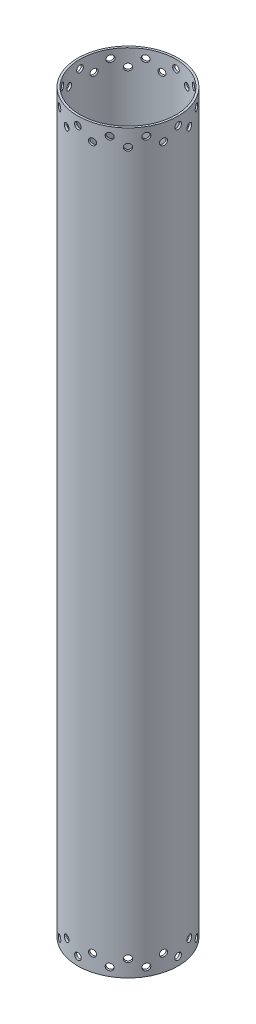
from build123d import *

# Parameters (mm, degrees)
SKETCH2_R                = 76.2
SKETCH2_R_2              = 73.025
BOSS_EXTRUDE1_DEPTH      = 1117.6
SKETCH3_R                = 5.0419
CUT_EXTRUDE1_DEPTH       = 1143
CIRPATTERN1_COUNT        = 12
SKETCH6_R                = 5.0419
CUT_EXTRUDE2_DEPTH       = 25.4
CIRPATTERN2_COUNT        = 12
MIRROR1_COPY_1_SKETCH_R  = 5.0419
MIRROR1_COPY_1_DEPTH     = 1143
MIRROR1_COPY_2_SKETCH_R  = 5.0419
MIRROR1_COPY_2_DEPTH     = 1143
MIRROR1_COPY_3_SKETCH_R  = 5.0419
MIRROR1_COPY_3_DEPTH     = 1143
MIRROR1_COPY_4_SKETCH_R  = 5.0419
MIRROR1_COPY_4_DEPTH     = 1143
MIRROR1_COPY_5_SKETCH_R  = 5.0419
MIRROR1_COPY_5_DEPTH     = 1143
MIRROR1_COPY_6_SKETCH_R  = 5.0419
MIRROR1_COPY_6_DEPTH     = 1143
MIRROR1_COPY_7_SKETCH_R  = 5.0419
MIRROR1_COPY_7_DEPTH     = 1143
MIRROR1_COPY_8_SKETCH_R  = 5.0419
MIRROR1_COPY_8_DEPTH     = 1143
MIRROR1_COPY_9_SKETCH_R  = 5.0419
MIRROR1_COPY_9_DEPTH     = 1143
MIRROR1_COPY_10_SKETCH_R = 5.0419
MIRROR1_COPY_10_DEPTH    = 1143
MIRROR1_COPY_11_SKETCH_R = 5.0419
MIRROR1_COPY_11_DEPTH    = 1143
MIRROR1_COPY_12_SKETCH_R = 5.0419
MIRROR1_COPY_12_DEPTH    = 1143
MIRROR1_COPY_13_SKETCH_R = 5.0419
MIRROR1_COPY_13_DEPTH    = 25.4
MIRROR1_COPY_14_SKETCH_R = 5.0419
MIRROR1_COPY_14_DEPTH    = 25.4
MIRROR1_COPY_15_SKETCH_R = 5.0419
MIRROR1_COPY_15_DEPTH    = 25.4
MIRROR1_COPY_16_SKETCH_R = 5.0419
MIRROR1_COPY_16_DEPTH    = 25.4
MIRROR1_COPY_17_SKETCH_R = 5.0419
MIRROR1_COPY_17_DEPTH    = 25.4
MIRROR1_COPY_18_SKETCH_R = 5.0419
MIRROR1_COPY_18_DEPTH    = 25.4
MIRROR1_COPY_19_SKETCH_R = 5.0419
MIRROR1_COPY_19_DEPTH    = 25.4
MIRROR1_COPY_20_SKETCH_R = 5.0419
MIRROR1_COPY_20_DEPTH    = 25.4
MIRROR1_COPY_21_SKETCH_R = 5.0419
MIRROR1_COPY_21_DEPTH    = 25.4
MIRROR1_COPY_22_SKETCH_R = 5.0419
MIRROR1_COPY_22_DEPTH    = 25.4
MIRROR1_COPY_23_SKETCH_R = 5.0419
MIRROR1_COPY_23_DEPTH    = 25.4
MIRROR1_COPY_24_SKETCH_R = 5.0419
MIRROR1_COPY_24_DEPTH    = 25.4


with BuildPart() as part:
    # Sketch2 → Boss-Extrude1 (new body)
    with BuildSketch(Plane(origin=(0, 0, 0), x_dir=(1, 0, 0), z_dir=(0, 1, 0))):
        Circle(SKETCH2_R)
        Circle(SKETCH2_R_2, mode=Mode.SUBTRACT)
    extrude(amount=BOSS_EXTRUDE1_DEPTH)

    # Sketch3 → Cut-Extrude1 (cut)
    with BuildSketch(Plane.XY):
        with Locations((0, 1104.9)):
            Circle(SKETCH3_R)
    cut_extrude1 = extrude(amount=-CUT_EXTRUDE1_DEPTH, mode=Mode.SUBTRACT)

    # CirPattern1: Cut-Extrude1 ×12 about axis
    cirpattern1_axis = Axis((0, 1117.6, 0), (0, -1, 0))
    for i in range(1, CIRPATTERN1_COUNT):
        add(cut_extrude1.rotate(cirpattern1_axis, i * 360 / CIRPATTERN1_COUNT), mode=Mode.SUBTRACT)

    # Sketch6 → Cut-Extrude2 (cut)
    with BuildSketch(Plane(origin=(-19.722011237, 0, 73.603547963), x_dir=(0, -1, 0), z_dir=(-0.25881904510252135, 0, 0.9659258262890681))):
        with Locations((-1092.2, 0)):
            Circle(SKETCH6_R)
    cut_extrude2 = extrude(amount=-CUT_EXTRUDE2_DEPTH, mode=Mode.SUBTRACT)

    # CirPattern2: Cut-Extrude2 ×12 about axis
    cirpattern2_axis = Axis((0, 1117.6, 0), (0, -1, 0))
    for i in range(1, CIRPATTERN2_COUNT):
        add(cut_extrude2.rotate(cirpattern2_axis, i * 360 / CIRPATTERN2_COUNT), mode=Mode.SUBTRACT)

    # Mirror1 copy 1 sketch → Mirror1 copy 1 (cut)
    with BuildSketch(Plane(origin=(0, 1117.6, 0), x_dir=(0.8660254037844387, 0, 0.49999999999999994), z_dir=(-0.49999999999999994, 0, 0.8660254037844387))):
        with Locations((0, -1104.9)):
            Circle(MIRROR1_COPY_1_SKETCH_R)
    extrude(amount=-MIRROR1_COPY_1_DEPTH, mode=Mode.SUBTRACT)

    # Mirror1 copy 2 sketch → Mirror1 copy 2 (cut)
    with BuildSketch(Plane(origin=(0, 1117.6, 0), x_dir=(0.5000000000000001, 0, 0.8660254037844386), z_dir=(-0.8660254037844386, 0, 0.5000000000000001))):
        with Locations((0, -1104.9)):
            Circle(MIRROR1_COPY_2_SKETCH_R)
    extrude(amount=-MIRROR1_COPY_2_DEPTH, mode=Mode.SUBTRACT)

    # Mirror1 copy 3 sketch → Mirror1 copy 3 (cut)
    with BuildSketch(Plane(origin=(0, 1117.6, 0), x_dir=(0, 0, 1), z_dir=(-1, 0, 0))):
        with Locations((0, -1104.9)):
            Circle(MIRROR1_COPY_3_SKETCH_R)
    extrude(amount=-MIRROR1_COPY_3_DEPTH, mode=Mode.SUBTRACT)

    # Mirror1 copy 4 sketch → Mirror1 copy 4 (cut)
    with BuildSketch(Plane(origin=(0, 1117.6, 0), x_dir=(-0.4999999999999998, 0, 0.8660254037844387), z_dir=(-0.8660254037844387, 0, -0.4999999999999998))):
        with Locations((0, -1104.9)):
            Circle(MIRROR1_COPY_4_SKETCH_R)
    extrude(amount=-MIRROR1_COPY_4_DEPTH, mode=Mode.SUBTRACT)

    # Mirror1 copy 5 sketch → Mirror1 copy 5 (cut)
    with BuildSketch(Plane(origin=(0, 1117.6, 0), x_dir=(-0.8660254037844387, 0, 0.49999999999999994), z_dir=(-0.49999999999999994, 0, -0.8660254037844387))):
        with Locations((0, -1104.9)):
            Circle(MIRROR1_COPY_5_SKETCH_R)
    extrude(amount=-MIRROR1_COPY_5_DEPTH, mode=Mode.SUBTRACT)

    # Mirror1 copy 6 sketch → Mirror1 copy 6 (cut)
    with BuildSketch(Plane(origin=(0, 1117.6, 0), x_dir=(-1, 0, 0), z_dir=(0, 0, -1))):
        with Locations((0, -1104.9)):
            Circle(MIRROR1_COPY_6_SKETCH_R)
    extrude(amount=-MIRROR1_COPY_6_DEPTH, mode=Mode.SUBTRACT)

    # Mirror1 copy 7 sketch → Mirror1 copy 7 (cut)
    with BuildSketch(Plane(origin=(0, 1117.6, 0), x_dir=(-0.8660254037844386, 0, -0.5000000000000001), z_dir=(0.5000000000000001, 0, -0.8660254037844386))):
        with Locations((0, -1104.9)):
            Circle(MIRROR1_COPY_7_SKETCH_R)
    extrude(amount=-MIRROR1_COPY_7_DEPTH, mode=Mode.SUBTRACT)

    # Mirror1 copy 8 sketch → Mirror1 copy 8 (cut)
    with BuildSketch(Plane(origin=(0, 1117.6, 0), x_dir=(-0.5000000000000004, 0, -0.8660254037844384), z_dir=(0.8660254037844384, 0, -0.5000000000000004))):
        with Locations((0, -1104.9)):
            Circle(MIRROR1_COPY_8_SKETCH_R)
    extrude(amount=-MIRROR1_COPY_8_DEPTH, mode=Mode.SUBTRACT)

    # Mirror1 copy 9 sketch → Mirror1 copy 9 (cut)
    with BuildSketch(Plane(origin=(0, 1117.6, 0), x_dir=(0, 0, -1), z_dir=(1, 0, 0))):
        with Locations((0, -1104.9)):
            Circle(MIRROR1_COPY_9_SKETCH_R)
    extrude(amount=-MIRROR1_COPY_9_DEPTH, mode=Mode.SUBTRACT)

    # Mirror1 copy 10 sketch → Mirror1 copy 10 (cut)
    with BuildSketch(Plane(origin=(0, 1117.6, 0), x_dir=(0.5000000000000001, 0, -0.8660254037844386), z_dir=(0.8660254037844386, 0, 0.5000000000000001))):
        with Locations((0, -1104.9)):
            Circle(MIRROR1_COPY_10_SKETCH_R)
    extrude(amount=-MIRROR1_COPY_10_DEPTH, mode=Mode.SUBTRACT)

    # Mirror1 copy 11 sketch → Mirror1 copy 11 (cut)
    with BuildSketch(Plane(origin=(0, 1117.6, 0), x_dir=(0.8660254037844384, 0, -0.5000000000000004), z_dir=(0.5000000000000004, 0, 0.8660254037844384))):
        with Locations((0, -1104.9)):
            Circle(MIRROR1_COPY_11_SKETCH_R)
    extrude(amount=-MIRROR1_COPY_11_DEPTH, mode=Mode.SUBTRACT)

    # Mirror1 copy 12 sketch → Mirror1 copy 12 (cut)
    with BuildSketch(Plane(origin=(0, 1117.6, 0), x_dir=(1, 0, 0), z_dir=(0, 0, 1))):
        with Locations((0, -1104.9)):
            Circle(MIRROR1_COPY_12_SKETCH_R)
    extrude(amount=-MIRROR1_COPY_12_DEPTH, mode=Mode.SUBTRACT)

    # Mirror1 copy 13 sketch → Mirror1 copy 13 (cut)
    with BuildSketch(Plane(origin=(-53.881536726, 1117.6, 53.881536726), x_dir=(0, 1, 0), z_dir=(-0.7071067811865479, 0, 0.7071067811865472))):
        with Locations((-1092.2, 0)):
            Circle(MIRROR1_COPY_13_SKETCH_R)
    extrude(amount=-MIRROR1_COPY_13_DEPTH, mode=Mode.SUBTRACT)

    # Mirror1 copy 14 sketch → Mirror1 copy 14 (cut)
    with BuildSketch(Plane(origin=(-73.603547963, 1117.6, 19.722011237), x_dir=(0, 1, 0), z_dir=(-0.9659258262890684, 0, 0.2588190451025203))):
        with Locations((-1092.2, 0)):
            Circle(MIRROR1_COPY_14_SKETCH_R)
    extrude(amount=-MIRROR1_COPY_14_DEPTH, mode=Mode.SUBTRACT)

    # Mirror1 copy 15 sketch → Mirror1 copy 15 (cut)
    with BuildSketch(Plane(origin=(-73.603547963, 1117.6, -19.722011237), x_dir=(0, 1, 0), z_dir=(-0.9659258262890681, 0, -0.2588190451025213))):
        with Locations((-1092.2, 0)):
            Circle(MIRROR1_COPY_15_SKETCH_R)
    extrude(amount=-MIRROR1_COPY_15_DEPTH, mode=Mode.SUBTRACT)

    # Mirror1 copy 16 sketch → Mirror1 copy 16 (cut)
    with BuildSketch(Plane(origin=(-53.881536726, 1117.6, -53.881536726), x_dir=(0, 1, 0), z_dir=(-0.7071067811865472, 0, -0.7071067811865477))):
        with Locations((-1092.2, 0)):
            Circle(MIRROR1_COPY_16_SKETCH_R)
    extrude(amount=-MIRROR1_COPY_16_DEPTH, mode=Mode.SUBTRACT)

    # Mirror1 copy 17 sketch → Mirror1 copy 17 (cut)
    with BuildSketch(Plane(origin=(-19.722011237, 1117.6, -73.603547963), x_dir=(0, 1, 0), z_dir=(-0.2588190451025201, 0, -0.9659258262890684))):
        with Locations((-1092.2, 0)):
            Circle(MIRROR1_COPY_17_SKETCH_R)
    extrude(amount=-MIRROR1_COPY_17_DEPTH, mode=Mode.SUBTRACT)

    # Mirror1 copy 18 sketch → Mirror1 copy 18 (cut)
    with BuildSketch(Plane(origin=(19.722011237, 1117.6, -73.603547963), x_dir=(0, 1, 0), z_dir=(0.25881904510252124, 0, -0.9659258262890681))):
        with Locations((-1092.2, 0)):
            Circle(MIRROR1_COPY_18_SKETCH_R)
    extrude(amount=-MIRROR1_COPY_18_DEPTH, mode=Mode.SUBTRACT)

    # Mirror1 copy 19 sketch → Mirror1 copy 19 (cut)
    with BuildSketch(Plane(origin=(53.881536726, 1117.6, -53.881536726), x_dir=(0, 1, 0), z_dir=(0.707106781186548, 0, -0.707106781186547))):
        with Locations((-1092.2, 0)):
            Circle(MIRROR1_COPY_19_SKETCH_R)
    extrude(amount=-MIRROR1_COPY_19_DEPTH, mode=Mode.SUBTRACT)

    # Mirror1 copy 20 sketch → Mirror1 copy 20 (cut)
    with BuildSketch(Plane(origin=(73.603547963, 1117.6, -19.722011237), x_dir=(0, 1, 0), z_dir=(0.9659258262890683, 0, -0.25881904510252063))):
        with Locations((-1092.2, 0)):
            Circle(MIRROR1_COPY_20_SKETCH_R)
    extrude(amount=-MIRROR1_COPY_20_DEPTH, mode=Mode.SUBTRACT)

    # Mirror1 copy 21 sketch → Mirror1 copy 21 (cut)
    with BuildSketch(Plane(origin=(73.603547963, 1117.6, 19.722011237), x_dir=(0, 1, 0), z_dir=(0.9659258262890681, 0, 0.2588190451025212))):
        with Locations((-1092.2, 0)):
            Circle(MIRROR1_COPY_21_SKETCH_R)
    extrude(amount=-MIRROR1_COPY_21_DEPTH, mode=Mode.SUBTRACT)

    # Mirror1 copy 22 sketch → Mirror1 copy 22 (cut)
    with BuildSketch(Plane(origin=(53.881536726, 1117.6, 53.881536726), x_dir=(0, 1, 0), z_dir=(0.707106781186547, 0, 0.707106781186548))):
        with Locations((-1092.2, 0)):
            Circle(MIRROR1_COPY_22_SKETCH_R)
    extrude(amount=-MIRROR1_COPY_22_DEPTH, mode=Mode.SUBTRACT)

    # Mirror1 copy 23 sketch → Mirror1 copy 23 (cut)
    with BuildSketch(Plane(origin=(19.722011237, 1117.6, 73.603547963), x_dir=(0, 1, 0), z_dir=(0.25881904510252063, 0, 0.9659258262890683))):
        with Locations((-1092.2, 0)):
            Circle(MIRROR1_COPY_23_SKETCH_R)
    extrude(amount=-MIRROR1_COPY_23_DEPTH, mode=Mode.SUBTRACT)

    # Mirror1 copy 24 sketch → Mirror1 copy 24 (cut)
    with BuildSketch(Plane(origin=(-19.722011237, 1117.6, 73.603547963), x_dir=(0, 1, 0), z_dir=(-0.25881904510252135, 0, 0.9659258262890681))):
        with Locations((-1092.2, 0)):
            Circle(MIRROR1_COPY_24_SKETCH_R)
    extrude(amount=-MIRROR1_COPY_24_DEPTH, mode=Mode.SUBTRACT)


solid = part.part
